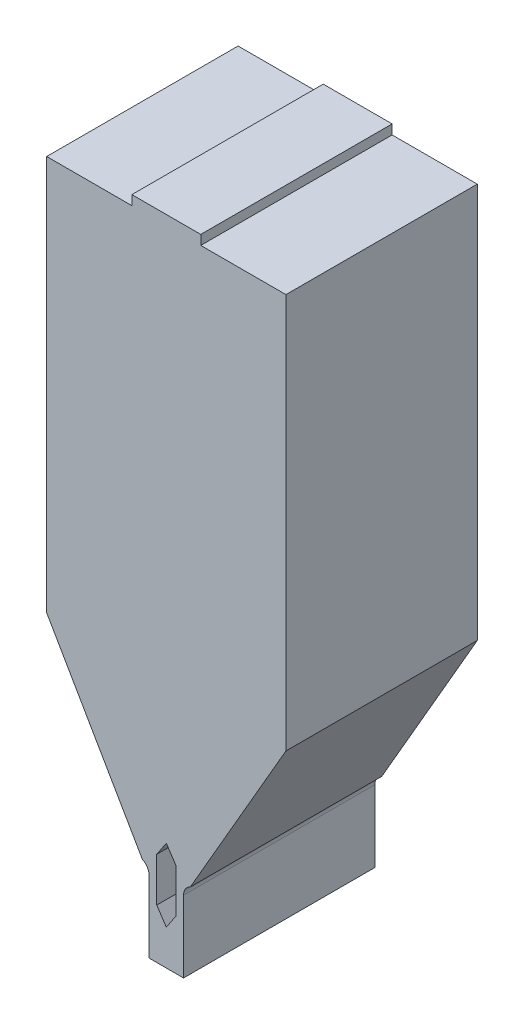
from build123d import *

# Parameters (mm, degrees)
AUFSATZ_LINEAR_AUSTRAGEN1_DEPTH = 200
AUFSATZ_LINEAR_AUSTRAGEN2_DEPTH = 10
SPIEGELN2_DEPTH                 = 96.337442911
SPIEGELN2_START                 = 104.471237307
SPIEGELN2_2_DEPTH               = 95.528762693
SPIEGELN2_START_2               = 96.337442911
SPIEGELN2_3_DEPTH               = 8.133794396


with BuildPart() as part:
    # Skizze1 → Aufsatz-Linear austragen1 (new body)
    with BuildSketch(Plane.XY):
        with BuildLine():
            Line((0, 38), (-1.4223e-13, 597.0183631567951))
            Line((-1.4223e-13, 597.0183631567951), (125, 597.0183631567951))
            Line((125, 597.0183631567951), (125, 183.98587038126252))
            Line((125, 183.98587038126252), (25.100000000000005, 10.953994705129267))
            ThreePointArc((25.100000000000005, 10.953994705129267), (19.930243299860727, 6.526867548832285), (18.000000000000007, -3.47e-15))
            Line((18.000000000000007, -3.47e-15), (18.000000000000007, -75))
            Line((18.000000000000007, -75), (0, -75))
            Line((0, -75), (0, -38.000000000000014))
            Line((0, -38.000000000000014), (10.000000000000002, -23.000000000000014))
            Line((10.000000000000002, -23.000000000000014), (10.000000000000007, -1.388e-14))
            Line((10.000000000000007, -1.388e-14), (10.000000000000002, 22.999999999999986))
            Line((10.000000000000002, 22.999999999999986), (0, 38))
        make_face()
    extrude(amount=AUFSATZ_LINEAR_AUSTRAGEN1_DEPTH)

    # Skizze2 → Aufsatz-Linear austragen2 (add)
    with BuildSketch(Plane(origin=(0, 597.0183631567951, 0), x_dir=(1, 0, 0), z_dir=(0, 1, 0))):
        Polygon((-1.4223e-13, -200), (35.99999999999986, -200), (35.999999999999865, 0), (1.225e-14, 0), align=None)
    extrude(amount=AUFSATZ_LINEAR_AUSTRAGEN2_DEPTH)

    # Skizze3 → Schnitt-Rotation1 (revolve, cut)
    with BuildSketch(Plane(origin=(0, 0, 0), x_dir=(0, 0, -1), z_dir=(1, 0, 0))):
        Polygon((-105.00000000000001, 72.00000000000001), (-107.50000000000001, 69.5), (-107.50000000000001, 0), (-100, 0), (-100, 72.00000000000001), (-100, 74.88675134594817), align=None)
    revolve(axis=Axis((0, 0, 100), (0, 1, 0)), mode=Mode.SUBTRACT)

    # Spiegeln2: read off the stored shape, not the designer's step
    # Spiegeln2 outline → Spiegeln2 (add)
    with BuildSketch(Plane.XY):
        with BuildLine():
            Line((-36, 607.018363157), (-36, 597.018363157))
            Line((-36, 597.018363157), (-125, 597.018363157))
            Line((-125, 597.018363157), (-125, 183.985870381))
            Line((-125, 183.985870381), (-25.1, 10.953994705))
            ThreePointArc((-25.1, 10.953994705), (-19.9302433, 6.526867549), (-18, 0))
            Line((-18, 0), (-18, -75))
            Line((-18, -75), (0, -75))
            Line((0, -75), (0, -38))
            Line((0, -38), (-10, -23))
            Line((-10, -23), (-10, 23))
            Line((-10, 23), (0, 38))
            Line((0, 38), (0, 607.018363157))
            Line((0, 607.018363157), (-36, 607.018363157))
        make_face()
    extrude(amount=SPIEGELN2_DEPTH)

    # Spiegeln2 2 outline → Spiegeln2 2 (add)
    with BuildSketch(Plane.XY.offset(SPIEGELN2_START)):
        with BuildLine():
            Line((-36, 607.018363157), (-36, 597.018363157))
            Line((-36, 597.018363157), (-125, 597.018363157))
            Line((-125, 597.018363157), (-125, 183.985870381))
            Line((-125, 183.985870381), (-25.1, 10.953994705))
            ThreePointArc((-25.1, 10.953994705), (-19.9302433, 6.526867549), (-18, 0))
            Line((-18, 0), (-18, -75))
            Line((-18, -75), (0, -75))
            Line((0, -75), (0, -38))
            Line((0, -38), (-10, -23))
            Line((-10, -23), (-10, 23))
            Line((-10, 23), (0, 38))
            Line((0, 38), (0, 607.018363157))
            Line((0, 607.018363157), (-36, 607.018363157))
        make_face()
    extrude(amount=SPIEGELN2_2_DEPTH)

    # Spiegeln2 3 outline → Spiegeln2 3 (add)
    with BuildSketch(Plane.XY.offset(SPIEGELN2_START_2)):
        with BuildLine():
            Line((-36, 607.018363157), (-36, 597.018363157))
            Line((-36, 597.018363157), (-125, 597.018363157))
            Line((-125, 597.018363157), (-125, 183.985870381))
            Line((-125, 183.985870381), (-25.1, 10.953994705))
            ThreePointArc((-25.1, 10.953994705), (-19.9302433, 6.526867549), (-18, 0))
            Line((-18, 0), (-18, -75))
            Line((-18, -75), (0, -75))
            Line((0, -75), (0, -38))
            Line((0, -38), (-10, -23))
            Line((-10, -23), (-10, 23))
            Line((-10, 23), (0, 38))
            Line((0, 38), (0, 607.018363157))
            Line((0, 607.018363157), (-36, 607.018363157))
        make_face()
    extrude(amount=SPIEGELN2_3_DEPTH)

    # Spiegeln2 4 outline → Spiegeln2 4 (revolve, cut)
    with BuildSketch(Plane.XY.offset(100)):
        Polygon((5, 72), (0, 74.886751346), (0, 26.711700462), (7.5, 26.711700462), (7.5, 69.5), align=None)
    revolve(axis=Axis((0, 0, 100), (0, 1, 0)), mode=Mode.SUBTRACT)


solid = part.part
